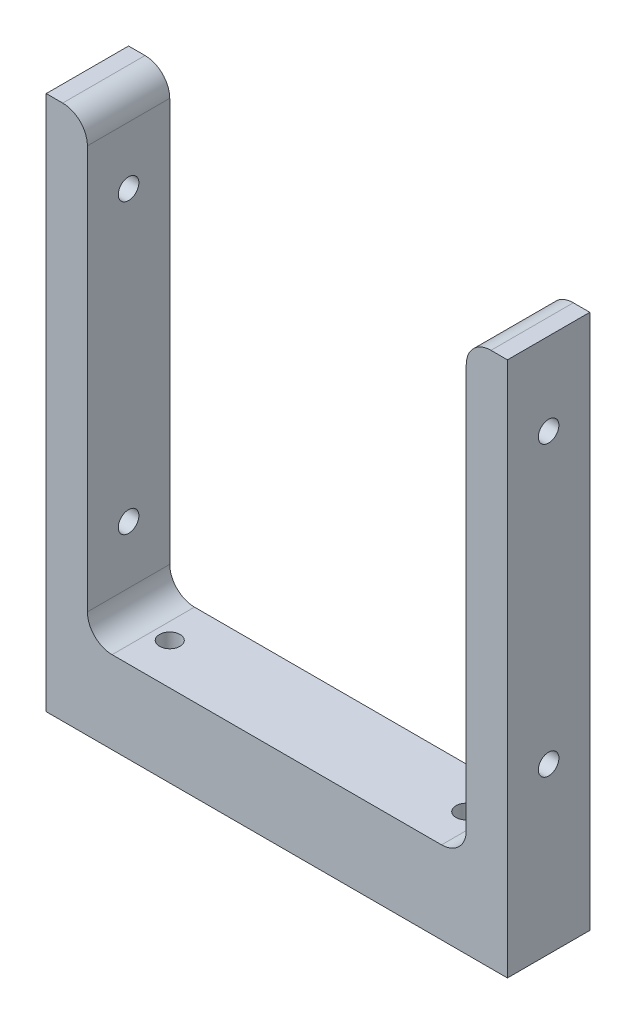
from build123d import *

# Parameters (mm, degrees)
EXTRUDE_1_DEPTH = 10
FILLET_1_R      = 3
M3X0_51_D       = 2.5
M3X0_52_D       = 2.5


with BuildPart() as part:
    # Эскиз1 → Бобышка-Вытянуть1 (new body)
    with BuildSketch(Plane.XY):
        Polygon((28, 32.5), (23, 32.5), (23, -22.5), (-23, -22.5), (-23, 32.5), (-28, 32.5), (-28, -32.5), (28, -32.5), align=None)
    extrude(amount=EXTRUDE_1_DEPTH)

    # Скругление1
    fillet_1_edges = [part.edges().sort_by_distance(p)[0] for p in [
        (23, -22.5, 5),
        (-23, -22.5, 5),
        (-23, 32.5, 5),
        (23, 32.5, 5),
    ]]
    fillet(fillet_1_edges, radius=FILLET_1_R)

    # Отверстие обработанное метчиком M3x0.51 (through all)
    with Locations(Plane(origin=(0, -32.5, 0), x_dir=(-1, 0, 0), z_dir=(0, -1, 0))):
        with Locations((18, -5), (-18, -5)):
            Hole(M3X0_51_D / 2)

    # Отверстие обработанное метчиком M3x0.52 (through all)
    with Locations(Plane(origin=(28, 0, 0), x_dir=(0, 0, -1), z_dir=(1, 0, 0))):
        with Locations((-5, 22.5), (-5, -12.5)):
            Hole(M3X0_52_D / 2)


solid = part.part
